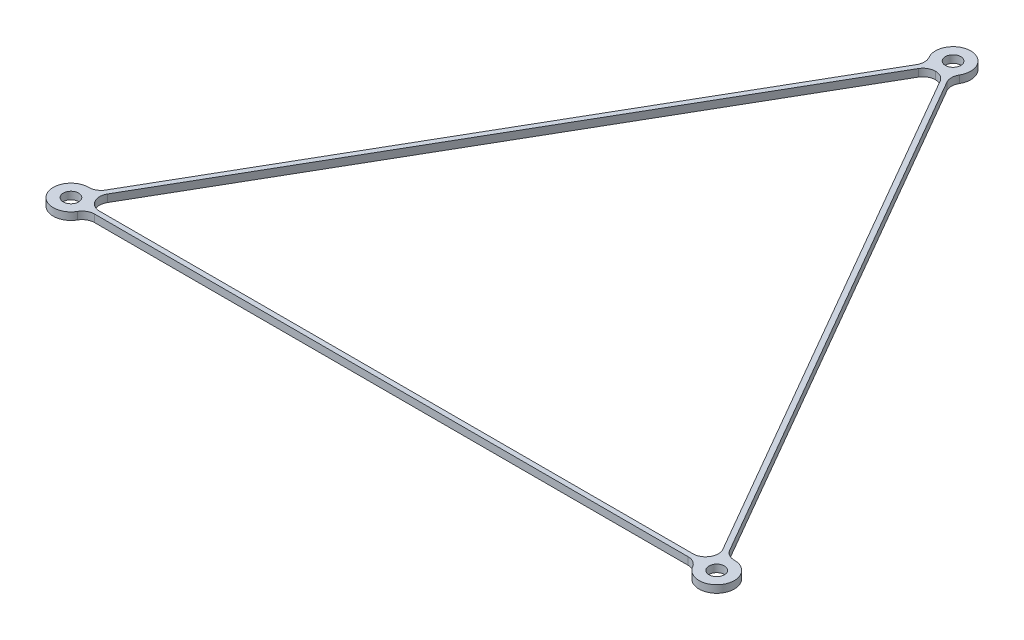
from build123d import *

# Parameters (mm, degrees)
SKETCH2_R        = 1.55
MAIN_SHAPE_DEPTH = 0.75
OUTSIDE_FILLET_R = 2.5
INSIDE_FILLET_R  = 2.5


with BuildPart() as part:
    # Sketch2 → main_shape (new, symmetric)
    with BuildSketch(Plane(origin=(0, 0, 0), x_dir=(1, 0, 0), z_dir=(0, 1, 0))):
        with BuildLine():
            Line((-63.675706525, -34.234023914), (-2.190318879, 72.261791411))
            ThreePointArc((-2.190318879, 72.261791411), (0, 78.605534995), (2.190318879, 72.261791411))
            Line((2.190318879, 72.261791411), (63.675706525, -34.234023914))
            ThreePointArc((63.675706525, -34.234023914), (68.074390183, -39.302767497), (61.485387646, -38.027767497))
            Line((61.485387646, -38.027767497), (-61.485387646, -38.027767497))
            ThreePointArc((-61.485387646, -38.027767497), (-68.074390183, -39.302767497), (-63.675706525, -34.234023914))
        make_face()
        with Locations((0, 75.055534995)):
            Circle(SKETCH2_R, mode=Mode.SUBTRACT)
        with Locations((65, -37.527767497)):
            Circle(SKETCH2_R, mode=Mode.SUBTRACT)
        with Locations((-65, -37.527767497)):
            Circle(SKETCH2_R, mode=Mode.SUBTRACT)
        with BuildLine():
            Line((-61.485387646, -37.027767497), (61.485387646, -37.027767497))
            ThreePointArc((61.485387646, -37.027767497), (61.925609817, -35.752767497), (62.809681121, -34.734023914))
            Line((62.809681121, -34.734023914), (1.324293475, 71.761791411))
            ThreePointArc((1.324293475, 71.761791411), (0, 71.505534995), (-1.324293475, 71.761791411))
            Line((-1.324293475, 71.761791411), (-62.809681121, -34.734023914))
            ThreePointArc((-62.809681121, -34.734023914), (-61.925609817, -35.752767497), (-61.485387646, -37.027767497))
        make_face(mode=Mode.SUBTRACT)
    extrude(amount=MAIN_SHAPE_DEPTH, both=True)

    # outside_fillet
    outside_fillet_edges = [part.edges().sort_by_distance(p)[0] for p in [
        (-2.190318879, 0, -72.261791411),
        (2.190318879, 0, -72.261791411),
        (63.675706525, 0, 34.234023914),
        (61.485387646, 0, 38.027767497),
        (-61.485387646, 0, 38.027767497),
        (-63.675706525, 0, 34.234023914),
    ]]
    fillet(outside_fillet_edges, radius=OUTSIDE_FILLET_R)

    # inside_fillet
    inside_fillet_edges = [part.edges().sort_by_distance(p)[0] for p in [
        (-62.809681121, 0, 34.734023914),
        (-61.485387646, 0, 37.027767497),
        (61.485387646, 0, 37.027767497),
        (62.809681121, 0, 34.734023914),
        (1.324293475, 0, -71.761791411),
        (-1.324293475, 0, -71.761791411),
    ]]
    fillet(inside_fillet_edges, radius=INSIDE_FILLET_R)


solid = part.part
